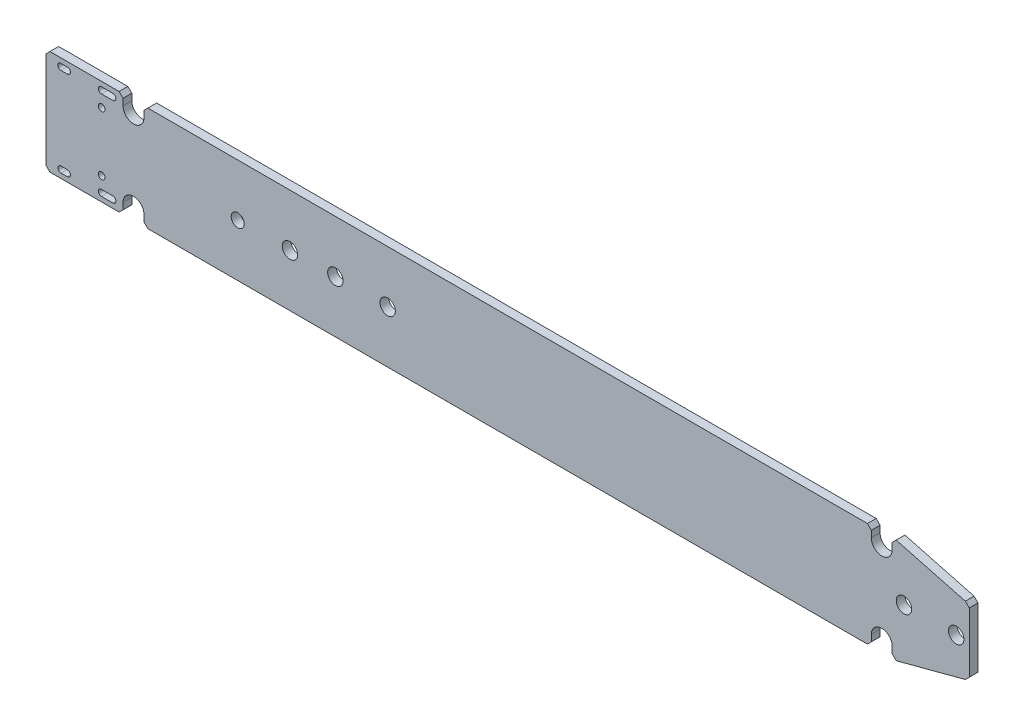
from build123d import *

# Parameters (mm, degrees)
EXTRUDE_1_OUTLINE_R = 0.325
EXTRUDE_1_DEPTH     = 0.85
SKETCH_1_R          = 0.635
SKETCH_1_R_2        = 0.750616105
CUT_EXTRUDE_1_DEPTH = 92.204552414


# Read off the part's stored shape, not the designer's step: 凸台-拉伸1
with BuildPart() as part:
    # 凸台-拉伸1 outline → 凸台-拉伸1 (new body)
    with BuildSketch(Plane.XY):
        with BuildLine():
            Line((81.153, -5.08), (81.534, -4.699))
            Line((81.534, -4.699), (81.534, -4.064))
            ThreePointArc((81.534, -4.064), (82.55, -3.048), (83.566, -4.064))
            Line((83.566, -4.064), (83.566, -4.699))
            Line((83.566, -4.699), (83.947, -5.08))
            Line((83.947, -5.08), (90.678, -3.3))
            Line((90.678, -3.3), (91.059, -2.919))
            Line((91.059, -2.919), (91.059, 0))
            Line((91.059, 0), (1.27, 0))
            Line((1.27, 0), (1.27, -4.699))
            Line((1.27, -4.699), (1.651, -5.08))
            Line((1.651, -5.08), (8.382, -5.08))
            Line((8.382, -5.08), (8.763, -4.699))
            Line((8.763, -4.699), (8.763, -4.064))
            ThreePointArc((8.763, -4.064), (9.779, -3.048), (10.795, -4.064))
            Line((10.795, -4.064), (10.795, -4.699))
            Line((10.795, -4.699), (11.176, -5.08))
            Line((11.176, -5.08), (81.153, -5.08))
        make_face()
        with BuildLine():
            Line((2.728, -4.02), (3.348, -4.02))
            ThreePointArc((3.348, -4.02), (3.648, -4.32), (3.348, -4.62))
            Line((3.348, -4.62), (2.728, -4.62))
            ThreePointArc((2.728, -4.62), (2.428, -4.32), (2.728, -4.02))
        make_face(mode=Mode.SUBTRACT)
        with BuildLine():
            Line((7.763, -4.62), (6.663, -4.62))
            ThreePointArc((6.663, -4.62), (6.363, -4.32), (6.663, -4.02))
            Line((6.663, -4.02), (7.763, -4.02))
            ThreePointArc((7.763, -4.02), (8.063, -4.32), (7.763, -4.62))
        make_face(mode=Mode.SUBTRACT)
        with Locations((6.683, -2.8687)):
            Circle(EXTRUDE_1_OUTLINE_R, mode=Mode.SUBTRACT)
    extrude_1 = extrude(amount=EXTRUDE_1_DEPTH)

    # 镜向1: 凸台-拉伸1 across plane
    add(extrude_1.mirror(Plane(origin=(0, 0, 0.85), x_dir=(0, 0, 1), z_dir=(0, 1, 0))))

    # 草图1 → 切除-拉伸1 (cut, through all)
    with BuildSketch(Plane.XY):
        with Locations((19.914, 0)):
            Circle(SKETCH_1_R)
        with Locations((24.994, 0)):
            Circle(SKETCH_1_R_2)
        with Locations((29.414, 0)):
            Circle(SKETCH_1_R_2)
        with Locations((34.494, 0)):
            Circle(SKETCH_1_R_2)
        with Locations((89.789, 0)):
            Circle(SKETCH_1_R_2)
        with Locations((84.709, 0)):
            Circle(SKETCH_1_R_2)
    extrude(amount=CUT_EXTRUDE_1_DEPTH, mode=Mode.SUBTRACT)


solid = part.part
